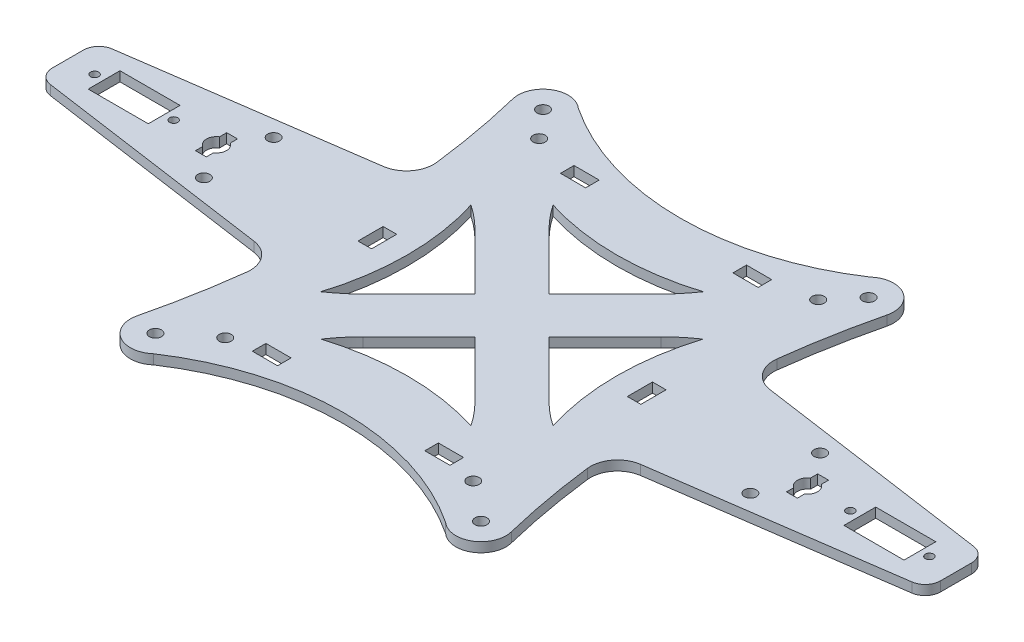
from build123d import *

# Parameters (mm, degrees)
SKETCH_1_R      = 1.55
SKETCH_1_R_2    = 1.05
SKETCH_1_W      = 6.5
SKETCH_1_H      = 3.5
SKETCH_1_W_2    = 3.5
SKETCH_1_H_2    = 6.5
SKETCH_1_W_3    = 15.5
SKETCH_1_H_3    = 8.2
EXTRUDE_1_DEPTH = 2.5
FILLET_1_R      = 4
FILLET_2_R      = 7


with BuildPart() as part:
    # 草图1 → 凸台-拉伸1 (new body)
    with BuildSketch(Plane(origin=(0, 0, 0), x_dir=(1, 0, 0), z_dir=(0, 1, 0))):
        with BuildLine():
            Line((114.591143215, 7.468307572), (114.591143215, -7.468307572))
            Line((114.591143215, -7.468307572), (43.193640968, -17.646273029))
            ThreePointArc((43.193640968, -17.646273029), (45.143245402, -33.15226541), (48.27557779, -48.463217404))
            ThreePointArc((48.27557779, -48.463217404), (45.335063646, -55.533708325), (37.709796983, -54.831018053))
            ThreePointArc((37.709796983, -54.831018053), (0, -43.436211003), (-37.709796983, -54.831018053))
            ThreePointArc((-37.709796983, -54.831018053), (-45.335063646, -55.533708325), (-48.27557779, -48.463217404))
            ThreePointArc((-48.27557779, -48.463217404), (-45.143245402, -33.15226541), (-43.193640968, -17.646273029))
            Line((-43.193640968, -17.646273029), (-114.591143215, -7.468307572))
            Line((-114.591143215, -7.468307572), (-114.591143215, 7.468307572))
            Line((-114.591143215, 7.468307572), (-43.193640968, 17.646273029))
            ThreePointArc((-43.193640968, 17.646273029), (-45.143245402, 33.15226541), (-48.27557779, 48.463217404))
            ThreePointArc((-48.27557779, 48.463217404), (-45.335063646, 55.533708325), (-37.709796983, 54.831018053))
            ThreePointArc((-37.709796983, 54.831018053), (0, 43.436211003), (37.709796983, 54.831018053))
            ThreePointArc((37.709796983, 54.831018053), (45.335063646, 55.533708325), (48.27557779, 48.463217404))
            ThreePointArc((48.27557779, 48.463217404), (45.143245402, 33.15226541), (43.193640968, 17.646273029))
            Line((43.193640968, 17.646273029), (114.591143215, 7.468307572))
        make_face()
        with Locations((-36, 43)):
            Circle(SKETCH_1_R, mode=Mode.SUBTRACT)
        with Locations((-32, -42)):
            Circle(SKETCH_1_R, mode=Mode.SUBTRACT)
        with Locations((32, -42)):
            Circle(SKETCH_1_R, mode=Mode.SUBTRACT)
        with Locations((36, 43)):
            Circle(SKETCH_1_R, mode=Mode.SUBTRACT)
        with Locations((42, 50)):
            Circle(SKETCH_1_R, mode=Mode.SUBTRACT)
        with Locations((42, -50)):
            Circle(SKETCH_1_R, mode=Mode.SUBTRACT)
        with Locations((-42, -50)):
            Circle(SKETCH_1_R, mode=Mode.SUBTRACT)
        with Locations((-42, 50)):
            Circle(SKETCH_1_R, mode=Mode.SUBTRACT)
        with Locations((107.7, 0)):
            Circle(SKETCH_1_R_2, mode=Mode.SUBTRACT)
        with Locations((87.3, 0)):
            Circle(SKETCH_1_R_2, mode=Mode.SUBTRACT)
        with Locations((-87.3, 0)):
            Circle(SKETCH_1_R_2, mode=Mode.SUBTRACT)
        with Locations((-107.7, 0)):
            Circle(SKETCH_1_R_2, mode=Mode.SUBTRACT)
        with Locations((70.5, 9)):
            Circle(SKETCH_1_R, mode=Mode.SUBTRACT)
        with Locations((70.5, -9)):
            Circle(SKETCH_1_R, mode=Mode.SUBTRACT)
        with Locations((-70.5, -9)):
            Circle(SKETCH_1_R, mode=Mode.SUBTRACT)
        with Locations((-70.5, 9)):
            Circle(SKETCH_1_R, mode=Mode.SUBTRACT)
        with Locations((-22.25, 39.75)):
            Rectangle(SKETCH_1_W, SKETCH_1_H, mode=Mode.SUBTRACT)
        with Locations((-34.75, 0)):
            Rectangle(SKETCH_1_W_2, SKETCH_1_H_2, mode=Mode.SUBTRACT)
        with Locations((-22.25, -39.75)):
            Rectangle(SKETCH_1_W, SKETCH_1_H, mode=Mode.SUBTRACT)
        with Locations((22.25, 39.75)):
            Rectangle(SKETCH_1_W, SKETCH_1_H, mode=Mode.SUBTRACT)
        with Locations((22.25, -39.75)):
            Rectangle(SKETCH_1_W, SKETCH_1_H, mode=Mode.SUBTRACT)
        with Locations((34.75, 0)):
            Rectangle(SKETCH_1_W_2, SKETCH_1_H_2, mode=Mode.SUBTRACT)
        with BuildLine():
            Line((77.65, -2.176778405), (77.65, -4.025))
            Line((77.65, -4.025), (74.85, -4.025))
            Line((74.85, -4.025), (74.85, -2.176778405))
            ThreePointArc((74.85, -2.176778405), (73.661880176, 0), (74.85, 2.176778405))
            Line((74.85, 2.176778405), (74.85, 4.025))
            Line((74.85, 4.025), (77.65, 4.025))
            Line((77.65, 4.025), (77.65, 2.176778405))
            ThreePointArc((77.65, 2.176778405), (78.838119824, 0), (77.65, -2.176778405))
        make_face(mode=Mode.SUBTRACT)
        with Locations((97.5, 0)):
            Rectangle(SKETCH_1_W_3, SKETCH_1_H_3, mode=Mode.SUBTRACT)
        with Locations((-97.5, 0)):
            Rectangle(SKETCH_1_W_3, SKETCH_1_H_3, mode=Mode.SUBTRACT)
        with BuildLine():
            Line((-74.85, -2.176778405), (-74.85, -4.025))
            Line((-74.85, -4.025), (-77.65, -4.025))
            Line((-77.65, -4.025), (-77.65, -2.176778405))
            ThreePointArc((-77.65, -2.176778405), (-78.838119824, 0), (-77.65, 2.176778405))
            Line((-77.65, 2.176778405), (-77.65, 4.025))
            Line((-77.65, 4.025), (-74.85, 4.025))
            Line((-74.85, 4.025), (-74.85, 2.176778405))
            ThreePointArc((-74.85, 2.176778405), (-73.661880176, 0), (-74.85, -2.176778405))
        make_face(mode=Mode.SUBTRACT)
        with BuildLine():
            Line((-23.978041684, 14.429581723), (-9.54845996, 0))
            Line((-9.54845996, 0), (-23.978041684, -14.429581723))
            ThreePointArc((-23.978041684, -14.429581723), (-26.851664039, -17.042325553), (-29.960234119, -19.370614155))
            ThreePointArc((-29.960234119, -19.370614155), (-27.006361348, 0), (-29.960234119, 19.370614155))
            ThreePointArc((-29.960234119, 19.370614155), (-26.851664039, 17.042325553), (-23.978041684, 14.429581723))
        make_face(mode=Mode.SUBTRACT)
        with BuildLine():
            Line((14.429581723, 23.978041684), (0, 9.54845996))
            Line((0, 9.54845996), (-14.429581723, 23.978041684))
            ThreePointArc((-14.429581723, 23.978041684), (-17.042325553, 26.851664039), (-19.370614155, 29.960234119))
            ThreePointArc((-19.370614155, 29.960234119), (0, 27.006361348), (19.370614155, 29.960234119))
            ThreePointArc((19.370614155, 29.960234119), (17.042325553, 26.851664039), (14.429581723, 23.978041684))
        make_face(mode=Mode.SUBTRACT)
        with BuildLine():
            Line((23.978041684, -14.429581723), (9.54845996, 0))
            Line((9.54845996, 0), (23.978041684, 14.429581723))
            ThreePointArc((23.978041684, 14.429581723), (26.851664039, 17.042325553), (29.960234119, 19.370614155))
            ThreePointArc((29.960234119, 19.370614155), (27.006361348, 0), (29.960234119, -19.370614155))
            ThreePointArc((29.960234119, -19.370614155), (26.851664039, -17.042325553), (23.978041684, -14.429581723))
        make_face(mode=Mode.SUBTRACT)
        with BuildLine():
            Line((-14.429581723, -23.978041684), (0, -9.54845996))
            Line((0, -9.54845996), (14.429581723, -23.978041684))
            ThreePointArc((14.429581723, -23.978041684), (17.042325553, -26.851664039), (19.370614155, -29.960234119))
            ThreePointArc((19.370614155, -29.960234119), (0, -27.006361348), (-19.370614155, -29.960234119))
            ThreePointArc((-19.370614155, -29.960234119), (-17.042325553, -26.851664039), (-14.429581723, -23.978041684))
        make_face(mode=Mode.SUBTRACT)
    extrude(amount=EXTRUDE_1_DEPTH)

    # 圆角1
    fillet_1_edges = [part.edges().sort_by_distance(p)[0] for p in [
        (114.591143215, 1.25, -7.468307572),
        (114.591143215, 1.25, 7.468307572),
        (-114.591143215, 1.25, -7.468307572),
        (-114.591143215, 1.25, 7.468307572),
    ]]
    fillet(fillet_1_edges, radius=FILLET_1_R)

    # 圆角2
    fillet_2_edges = [part.edges().sort_by_distance(p)[0] for p in [
        (-43.193640968, 1.25, -17.646273029),
        (43.193640968, 1.25, -17.646273029),
        (43.193640968, 1.25, 17.646273029),
        (-43.193640968, 1.25, 17.646273029),
    ]]
    fillet(fillet_2_edges, radius=FILLET_2_R)


solid = part.part
